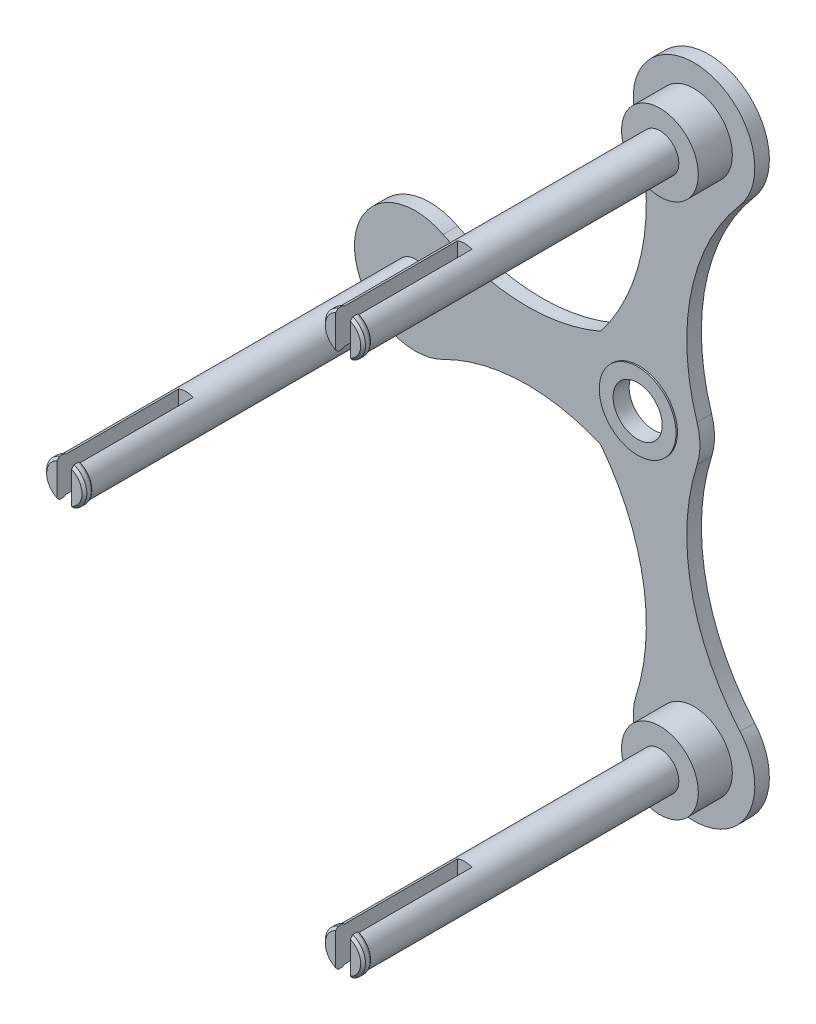
from build123d import *

# Parameters (mm, degrees)
ESQUISSE1_R             = 5.05
BOSS_EXTRU_1_DEPTH      = 3
ESQUISSE1_3_R           = 3.885
BOSS_EXTRU_2_DEPTH      = 73.39
ESQUISSE2_R             = 7.89
BOSS_EXTRU_3_DEPTH      = 7
ESQUISSE5_R             = 7.89
ESQUISSE5_R_2           = 5.05
BOSS_EXTRU_6_DEPTH      = 0.3
ESQUISSE7_R             = 4.135
BOSS_EXTRU_7_DEPTH      = 1.75
CHANFREIN1_SIZE         = 0.5
CONG_1_R                = 0.5
ESQUISSE8_W             = 3
ESQUISSE8_H             = 10
ENL_V_MAT_EXTRU_2_DEPTH = 25


with BuildPart() as part:
    # Esquisse1 → Boss.-Extru.1 (new body)
    with BuildSketch(Plane(origin=(0, 0, 0), x_dir=(0, 1, 0), z_dir=(0, 0, 1))):
        with BuildLine():
            ThreePointArc((-51.213463933, 11.912688387), (-67.245123648, -2.511363541), (-46.830014328, -9.460514474))
            ThreePointArc((-46.830014328, -9.460514474), (-26.458974656, 0.564078553), (-3.786536067, -0.632688387))
            ThreePointArc((-3.786536067, -0.632688387), (0, -1.22), (3.786536067, -0.632688387))
            ThreePointArc((3.786536067, -0.632688387), (26.458974656, 0.564078553), (46.830014328, -9.460514474))
            ThreePointArc((46.830014328, -9.460514474), (67.245123648, -2.511363541), (51.213463933, 11.912688387))
            ThreePointArc((51.213463933, 11.912688387), (29.759042799, 10.483556734), (10.090692451, 19.172089298))
            ThreePointArc((10.090692451, 19.172089298), (6.97776739, 35.495762016), (11.128295551, 51.586930693))
            ThreePointArc((11.128295551, 51.586930693), (0, 69.78), (-11.128295551, 51.586930693))
            ThreePointArc((-11.128295551, 51.586930693), (-6.97776739, 35.495762016), (-10.090692451, 19.172089298))
            ThreePointArc((-10.090692451, 19.172089298), (-29.759042799, 10.483556734), (-51.213463933, 11.912688387))
        make_face()
        with Locations(Location((0, 11.28, 0), (0, 0, 270))):
            Circle(ESQUISSE1_R, mode=Mode.SUBTRACT)
    extrude(amount=BOSS_EXTRU_1_DEPTH)

    # Esquisse1<3> → Boss.-Extru.2 (add)
    with BuildSketch(Plane(origin=(0, 0, 0), x_dir=(0, 1, 0), z_dir=(0, 0, 1))):
        with Locations(Location((-55, 0, 0), (0, 0, 270))):
            Circle(ESQUISSE1_3_R)
        with Locations(Location((55, 0, 0), (0, 0, 270))):
            Circle(ESQUISSE1_3_R)
        with Locations(Location((0, 57.28, 0), (0, 0, 270))):
            Circle(ESQUISSE1_3_R)
    extrude(amount=BOSS_EXTRU_2_DEPTH)

    # Esquisse2 → Boss.-Extru.3 (add)
    with BuildSketch(Plane.XY.offset(3)):
        with Locations((0, -55)):
            Circle(ESQUISSE2_R)
        with Locations((0, 55)):
            Circle(ESQUISSE2_R)
    extrude(amount=BOSS_EXTRU_3_DEPTH)

    # Esquisse5 → Boss.-Extru.6 (add)
    with BuildSketch(Plane.XY.offset(3)):
        with Locations((-11.28, 0)):
            Circle(ESQUISSE5_R)
        with Locations((-11.28, 0)):
            Circle(ESQUISSE5_R_2, mode=Mode.SUBTRACT)
    extrude(amount=BOSS_EXTRU_6_DEPTH)

    # Esquisse7 → Boss.-Extru.7 (add)
    with BuildSketch(Plane.XY.offset(73.39)):
        with Locations((-57.28, 0)):
            Circle(ESQUISSE7_R)
        with Locations((0, 55)):
            Circle(ESQUISSE7_R)
        with Locations((0, -55)):
            Circle(ESQUISSE7_R)
    extrude(amount=BOSS_EXTRU_7_DEPTH)

    # Chanfrein1
    chanfrein1_edges = [part.edges().sort_by_distance(p)[0] for p in [
        (-61.415, 0, 75.14),
        (-4.135, -55, 75.14),
        (-4.135, 55, 75.14),
    ]]
    chamfer(chanfrein1_edges, length=CHANFREIN1_SIZE)

    # Congé1
    # the kernel refuses this fillet: 0.5 mm, written as the material it takes off along each edge
    with BuildSketch(Plane(origin=(-57.28, 0, 73.39), x_dir=(1, 0, 0), z_dir=(0, -1, 0))) as cong_1_piece_1:
        with BuildLine():
            CenterArc((3.635, 0.433012702), CONG_1_R, 300, 60)
            Line((3.885, 0), (3.89, -0.008660254))
            ThreePointArc((3.89, -0.008660254), (4.01, -0.01), (4.135, -0.01))
            Line((4.135, -0.01), (4.145, 0))
            Line((4.145, 0), (4.145, 0.433012702))
            Line((4.145, 0.433012702), (4.135, 0.433012702))
        make_face()
    revolve(axis=Axis((-57.28, 0, 73.39), (0, 0, 1)), mode=Mode.SUBTRACT)
    with BuildSketch(Plane(origin=(0, -55, 73.39), x_dir=(1, 0, 0), z_dir=(0, -1, 0))) as cong_1_piece_2:
        with BuildLine():
            CenterArc((3.635, 0.433012702), CONG_1_R, 300, 60)
            Line((4.135, 0.433012702), (4.145, 0.433012702))
            Line((4.145, 0.433012702), (4.145, 0))
            Line((4.145, 0), (4.135, -0.01))
            ThreePointArc((4.135, -0.01), (4.01, -0.01), (3.89, -0.008660254))
            Line((3.89, -0.008660254), (3.885, 0))
        make_face()
    revolve(axis=Axis((0, -55, 73.39), (0, 0, 1)), mode=Mode.SUBTRACT)
    with BuildSketch(Plane(origin=(0, 55, 73.39), x_dir=(1, 0, 0), z_dir=(0, -1, 0))) as cong_1_piece_3:
        with BuildLine():
            CenterArc((3.635, 0.433012702), CONG_1_R, 300, 60)
            Line((4.135, 0.433012702), (4.145, 0.433012702))
            Line((4.145, 0.433012702), (4.145, 0))
            Line((4.145, 0), (4.135, -0.01))
            ThreePointArc((4.135, -0.01), (4.01, -0.01), (3.89, -0.008660254))
            Line((3.89, -0.008660254), (3.885, 0))
        make_face()
    revolve(axis=Axis((0, 55, 73.39), (0, 0, 1)), mode=Mode.SUBTRACT)

    # Esquisse8 → Enlèv. mat.-Extru.2 (cut)
    with BuildSketch(Plane.XY.offset(75.14)):
        with Locations((-57.28, 0)):
            Rectangle(ESQUISSE8_W, ESQUISSE8_H)
        with Locations((0, -55)):
            Rectangle(ESQUISSE8_W, ESQUISSE8_H)
        with Locations((0, 55)):
            Rectangle(ESQUISSE8_W, ESQUISSE8_H)
    extrude(amount=-ENL_V_MAT_EXTRU_2_DEPTH, mode=Mode.SUBTRACT)


solid = part.part
